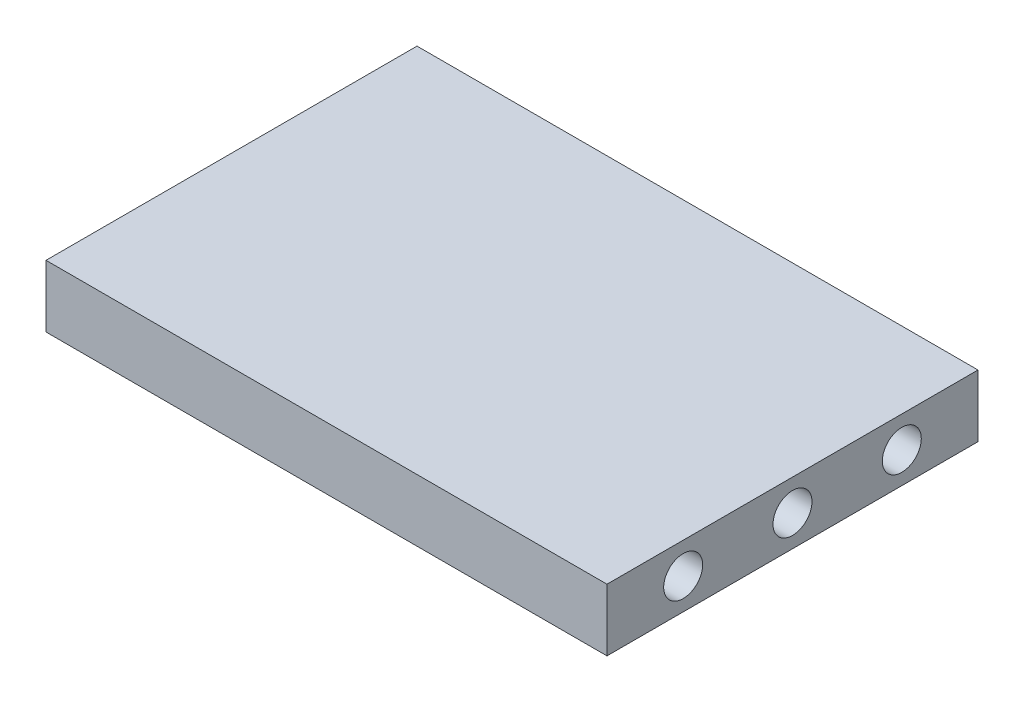
from build123d import *

# Parameters (mm, degrees)
SKETCH1_W           = 28.448
SKETCH1_H           = 4.7625
SKETCH1_R           = 1.493994908
BOSS_EXTRUDE1_DEPTH = 43.0149


with BuildPart() as part:
    # Sketch1 → Boss-Extrude1 (new body)
    with BuildSketch(Plane(origin=(0, 0, 0), x_dir=(0, 0, -1), z_dir=(1, 0, 0))):
        Rectangle(SKETCH1_W, SKETCH1_H)
        with Locations((8.382, 0)):
            Circle(SKETCH1_R, mode=Mode.SUBTRACT)
        Circle(SKETCH1_R, mode=Mode.SUBTRACT)
        with Locations((-8.382, 0)):
            Circle(SKETCH1_R, mode=Mode.SUBTRACT)
    extrude(amount=BOSS_EXTRUDE1_DEPTH)


solid = part.part
